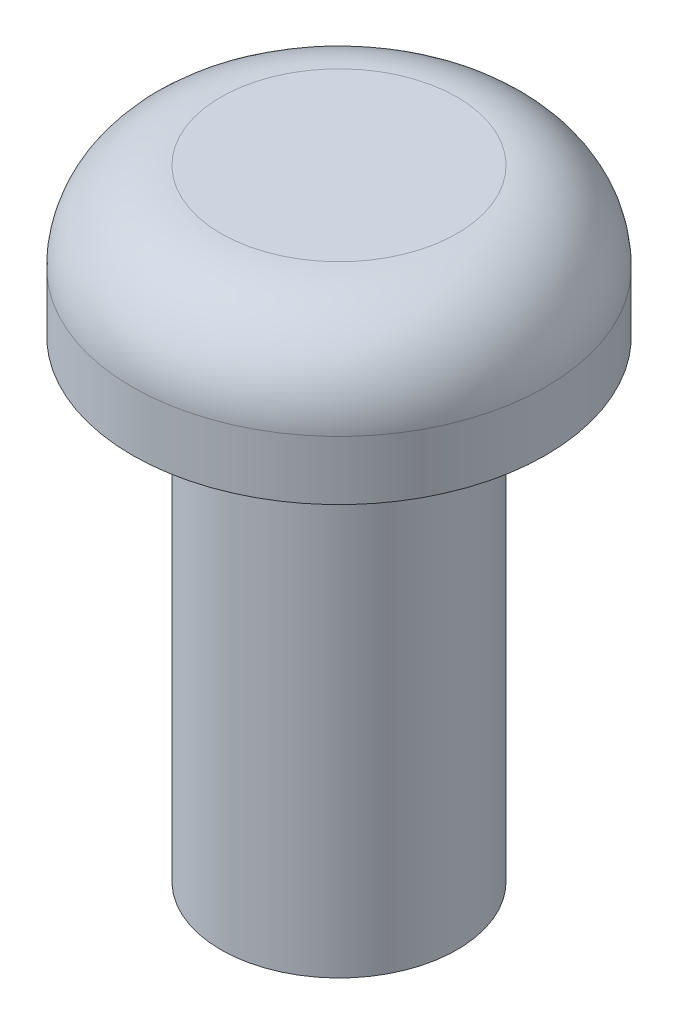
from build123d import *


with BuildPart() as part:
    # Sketch1 → Revolve1 (revolve)
    with BuildSketch(Plane.XY):
        with BuildLine():
            Line((2, 0), (3.5, 0))
            Line((3.5, 0), (3.5, 1))
            ThreePointArc((3.5, 1), (3.060660172, 2.060660172), (2, 2.5))
            Line((2, 2.5), (0, 2.5))
            Line((0, 2.5), (0, -8))
            Line((0, -8), (2, -8))
            Line((2, -8), (2, 0))
        make_face()
    revolve(axis=Axis((0, -8, 0), (0, 1, 0)))


solid = part.part
